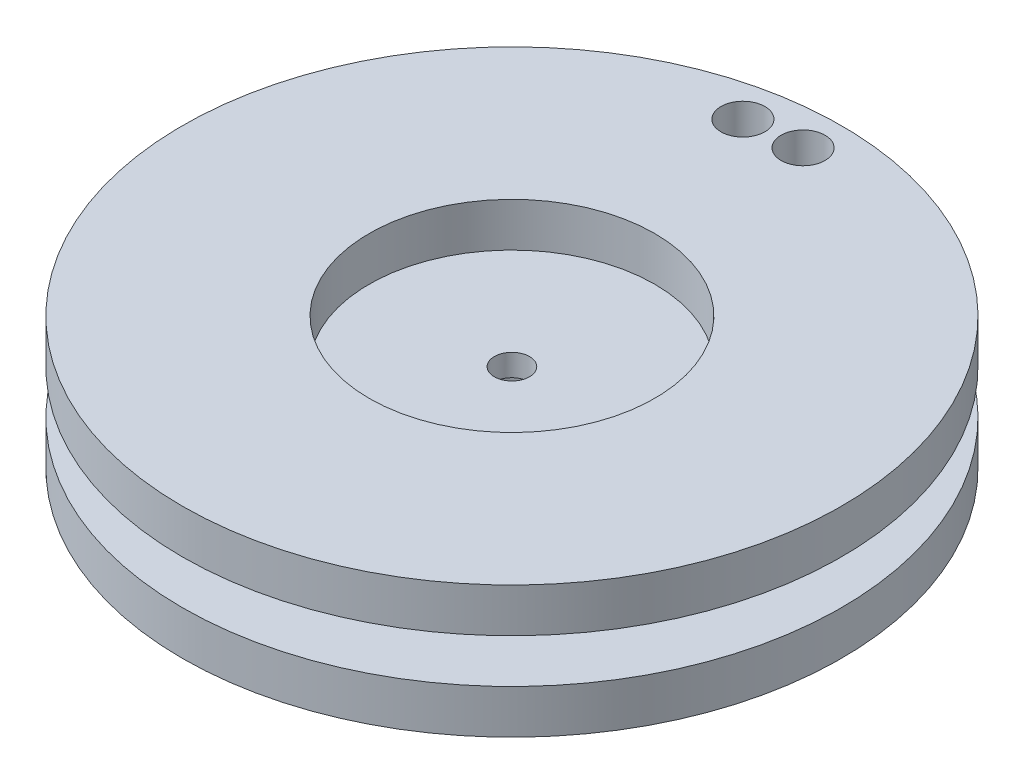
from build123d import *

# Parameters (mm, degrees)
SKETCH1_R           = 15
BOSS_EXTRUDE1_DEPTH = 2
SKETCH2_R           = 12
BOSS_EXTRUDE2_DEPTH = 2
SKETCH3_R           = 15
BOSS_EXTRUDE3_DEPTH = 2
SKETCH6_R           = 2.5
CUT_EXTRUDE5_DEPTH  = 3
SKETCH4_R           = 6.5
CUT_EXTRUDE6_DEPTH  = 2
SKETCH10_R          = 0.8
CUT_EXTRUDE7_DEPTH  = 22.587033145
SKETCH11_R          = 1
CUT_EXTRUDE8_DEPTH  = 23.045407685


with BuildPart() as part:
    # Sketch1 → Boss-Extrude1 (new body)
    with BuildSketch(Plane(origin=(0, 0, 0), x_dir=(1, 0, 0), z_dir=(0, 1, 0))):
        Circle(SKETCH1_R)
    extrude(amount=BOSS_EXTRUDE1_DEPTH)

    # Sketch2 → Boss-Extrude2 (add)
    with BuildSketch(Plane(origin=(0, 2, 0), x_dir=(1, 0, 0), z_dir=(0, 1, 0))):
        Circle(SKETCH2_R)
    extrude(amount=BOSS_EXTRUDE2_DEPTH)

    # Sketch3 → Boss-Extrude3 (add)
    with BuildSketch(Plane(origin=(0, 4, 0), x_dir=(1, 0, 0), z_dir=(0, 1, 0))):
        Circle(SKETCH3_R)
    extrude(amount=BOSS_EXTRUDE3_DEPTH)

    # Sketch6 → Cut-Extrude5 (cut)
    with BuildSketch(Plane.XZ):
        Circle(SKETCH6_R)
    extrude(amount=-CUT_EXTRUDE5_DEPTH, mode=Mode.SUBTRACT)

    # Sketch4 → Cut-Extrude6 (cut)
    with BuildSketch(Plane(origin=(0, 6, 0), x_dir=(1, 0, 0), z_dir=(0, 1, 0))):
        Circle(SKETCH4_R)
    extrude(amount=-CUT_EXTRUDE6_DEPTH, mode=Mode.SUBTRACT)

    # Sketch10 → Cut-Extrude7 (cut, through all)
    with BuildSketch(Plane(origin=(0, 4, 0), x_dir=(1, 0, 0), z_dir=(0, 1, 0))):
        Circle(SKETCH10_R)
    extrude(amount=-CUT_EXTRUDE7_DEPTH, mode=Mode.SUBTRACT)

    # Sketch11 → Cut-Extrude8 (cut, through all)
    with BuildSketch(Plane(origin=(0, 6, 0), x_dir=(1, 0, 0), z_dir=(0, 1, 0))):
        with Locations((0, 13.25)):
            Circle(SKETCH11_R)
        with Locations((-2.5, 13.01201368)):
            Circle(SKETCH11_R)
    extrude(amount=-CUT_EXTRUDE8_DEPTH, mode=Mode.SUBTRACT)


solid = part.part
